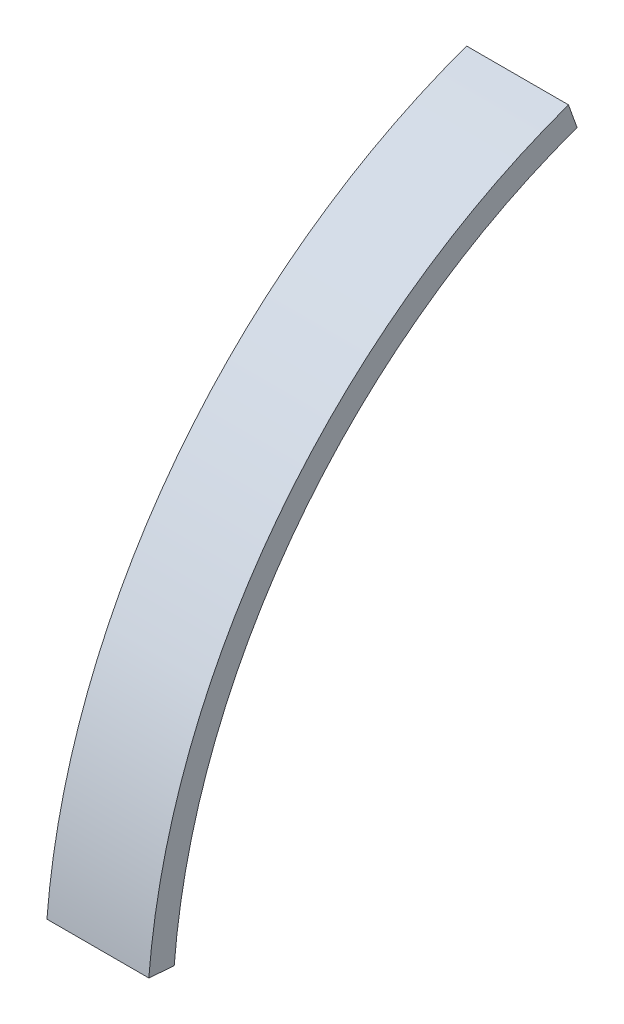
from build123d import *

# Parameters (mm, degrees)
BASE_FLANGE1_DEPTH = 6.35


# Sheet-metal steps are written as plain solids
with BuildPart() as part:
    # Sketch2 → Base-Flange1 (new, symmetric)
    with BuildSketch(Plane(origin=(0, 0, 0), x_dir=(0, 0, -1), z_dir=(1, 0, 0))):
        with BuildLine():
            ThreePointArc((0.265044281, 6.35), (15.769509783, 46.41762437), (50.484158893, 71.7296))
            Line((50.484158893, 71.7296), (49.412665514, 74.718333333))
            ThreePointArc((49.412665514, 74.718333333), (13.251572691, 48.351692052), (-2.898912207, 6.614583333))
            Line((-2.898912207, 6.614583333), (0.265044281, 6.35))
        make_face()
    extrude(amount=BASE_FLANGE1_DEPTH, both=True)


solid = part.part
